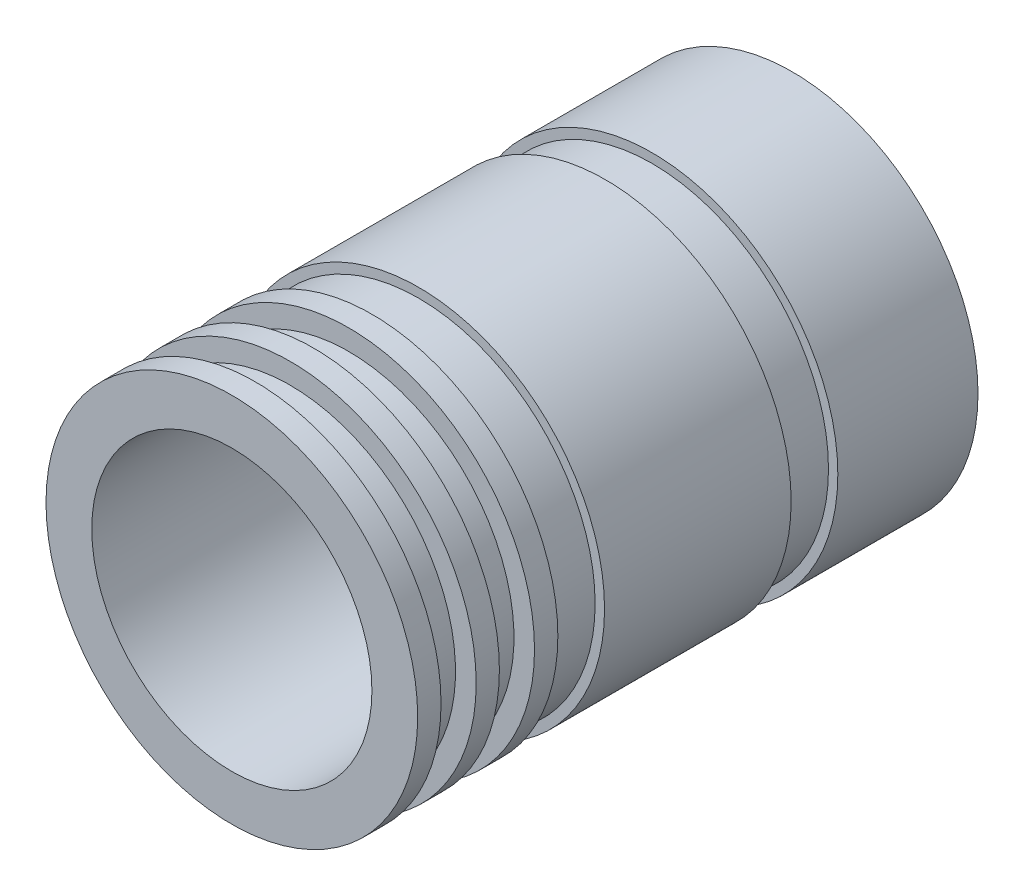
from build123d import *

# Parameters (mm, degrees)
SKETCH1_R           = 25.273
BOSS_EXTRUDE1_DEPTH = 76.2
SKETCH5_R           = 19.05
CUT_EXTRUDE2_DEPTH  = 76.2


with BuildPart() as part:
    # Sketch1 → Boss-Extrude1 (new body)
    with BuildSketch(Plane.XY):
        Circle(SKETCH1_R)
    extrude(amount=BOSS_EXTRUDE1_DEPTH)

    # Sketch5 → Cut-Extrude2 (cut)
    with BuildSketch(Plane.XY.offset(76.2)):
        Circle(SKETCH5_R)
    extrude(amount=-CUT_EXTRUDE2_DEPTH, mode=Mode.SUBTRACT)

    # Cut-Sweep4: sweep along a path in groove path
    with BuildLine(Plane.XY.offset(60.3123)) as cut_sweep4_path:
        CenterArc((0, 0), 25.273, 0, 360)
    # Groove → Cut-Sweep4 (sweep, cut)
    with BuildSketch(Plane(origin=(0, 0, 0), x_dir=(0, 0, -1), z_dir=(1, 0, 0))):
        Polygon((-73.025, 25.273), (-73.025, 22.479), (-68.2625, 22.479), (-68.244704377, 25.273), (-65.0875, 25.273), (-65.0875, 22.479), (-60.3123, 22.479), (-60.3123, 25.273), (-57.1373, 25.273), (-57.1373, 24.003), (-50.8, 24.003), (-50.7873, 25.273), (-50.7873, 27.723939067), (-73.025, 27.723939067), align=None)
        Polygon((-19.0627, 27.723939067), (-25.4127, 27.723939067), (-25.4127, 25.273), (-25.4, 24.003), (-19.0627, 24.003), (-19.0627, 25.273), align=None)
    sweep(path=cut_sweep4_path.line, mode=Mode.SUBTRACT)

    # Cut-Sweep5: sweep along a path in Sketch14
    with BuildLine(Plane(origin=(0, 0, 11.0656468), x_dir=(-1, 0, 0), z_dir=(0, 0, -1))) as cut_sweep5_path:
        CenterArc((0, 0), 19.05, 0, 360)
    # Sketch6 → Cut-Sweep5 (sweep, cut)
    with BuildSketch(Plane(origin=(0, 0, 0), x_dir=(0, 0, -1), z_dir=(1, 0, 0))):
        Polygon((-3.1281468, 0), (-41.2281468, 0), (-41.2281468, 21.844320112), (-36.4656468, 21.844320112), (-36.4656468, 18.034), (-7.9375, 18.034), (-7.9375, 21.844), (-3.1281468, 21.844), align=None)
    sweep(path=cut_sweep5_path.line, mode=Mode.SUBTRACT)


solid = part.part
